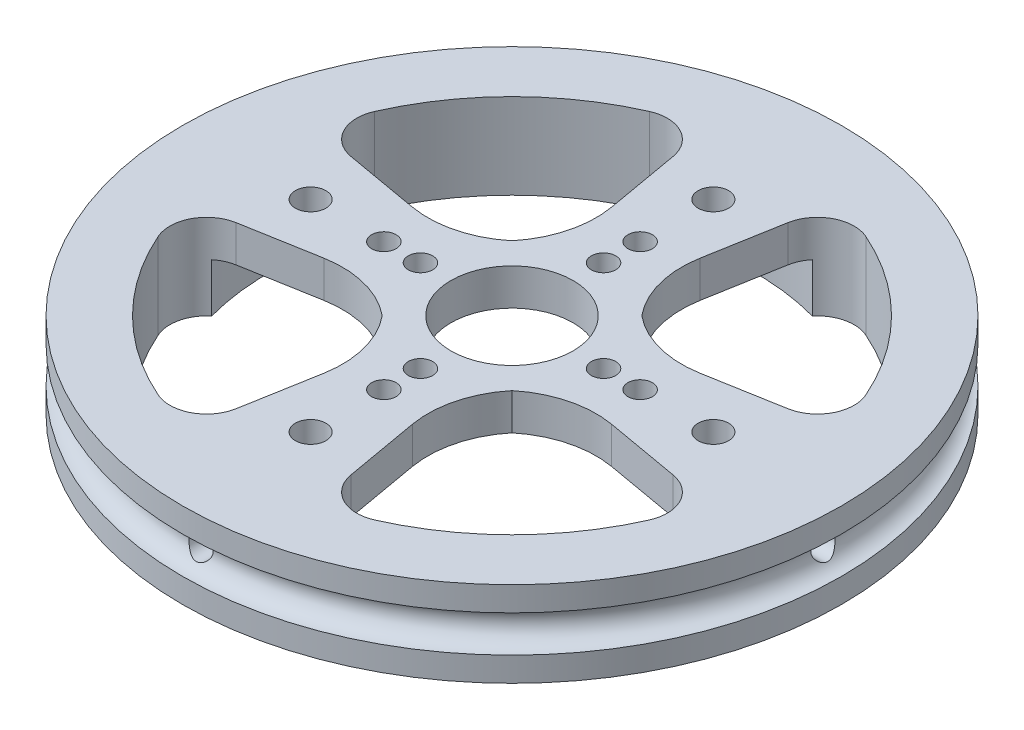
from build123d import *

# Parameters (mm, degrees)
SKETCH1_R           = 27
SKETCH1_R_2         = 5
SKETCH1_R_3         = 1
SKETCH1_R_4         = 1.25
BOSS_EXTRUDE1_DEPTH = 2
SKETCH3_R           = 27
SKETCH3_R_2         = 1.25
SKETCH3_R_3         = 1
SKETCH3_R_4         = 5
BOSS_EXTRUDE3_DEPTH = 2
SKETCH5_R           = 20
CUT_EXTRUDE1_DEPTH  = 4
SKETCH7_R           = 1
CUT_EXTRUDE2_DEPTH  = 7
CIRPATTERN1_COUNT   = 4
FILLET2_R           = 2
CUT_EXTRUDE3_START  = -10
SKETCH10_R          = 5
SKETCH10_R_2        = 1.25
SKETCH10_R_3        = 1
CUT_EXTRUDE3_DEPTH  = 10
FILLET3_R           = 8
FILLET4_R           = 3


with BuildPart() as part:
    # Sketch1 → Boss-Extrude1 (new body)
    with BuildSketch(Plane(origin=(0, 0, 0), x_dir=(1, 0, 0), z_dir=(0, 1, 0))):
        with Locations(Location((0, 0, 0), (0, 0, 270))):
            Circle(SKETCH1_R)
        with Locations(Location((0, 0, 0), (0, 0, 270))):
            Circle(SKETCH1_R_2, mode=Mode.SUBTRACT)
        with Locations(Location((-7.5, 0, 0), (0, 0, 270))):
            Circle(SKETCH1_R_3, mode=Mode.SUBTRACT)
        with Locations(Location((-10.5, 0, 0), (0, 0, 270))):
            Circle(SKETCH1_R_3, mode=Mode.SUBTRACT)
        with Locations(Location((0, 10.5, 0), (0, 0, 270))):
            Circle(SKETCH1_R_3, mode=Mode.SUBTRACT)
        with Locations(Location((10.5, 0, 0), (0, 0, 270))):
            Circle(SKETCH1_R_3, mode=Mode.SUBTRACT)
        with Locations(Location((0, -10.5, 0), (0, 0, 270))):
            Circle(SKETCH1_R_3, mode=Mode.SUBTRACT)
        with Locations(Location((0, 7.5, 0), (0, 0, 270))):
            Circle(SKETCH1_R_3, mode=Mode.SUBTRACT)
        with Locations(Location((7.5, 0, 0), (0, 0, 270))):
            Circle(SKETCH1_R_3, mode=Mode.SUBTRACT)
        with Locations(Location((0, -7.5, 0), (0, 0, 270))):
            Circle(SKETCH1_R_3, mode=Mode.SUBTRACT)
        with Locations(Location((-16.5, 0, 0), (0, 0, 270))):
            Circle(SKETCH1_R_4, mode=Mode.SUBTRACT)
        with Locations(Location((0, 16.5, 0), (0, 0, 270))):
            Circle(SKETCH1_R_4, mode=Mode.SUBTRACT)
        with Locations(Location((16.5, 0, 0), (0, 0, 270))):
            Circle(SKETCH1_R_4, mode=Mode.SUBTRACT)
        with Locations(Location((0, -16.5, 0), (0, 0, 270))):
            Circle(SKETCH1_R_4, mode=Mode.SUBTRACT)
        with BuildLine():
            Line((-6.968485669, 2.773122334), (-21.338950819, 5.307023065))
            ThreePointArc((-21.338950819, 5.307023065), (-15.548558066, 15.548558066), (-5.307023065, 21.338950819))
            Line((-5.307023065, 21.338950819), (-2.773122334, 6.968485669))
            ThreePointArc((-2.773122334, 6.968485669), (-5.303300859, 5.303300859), (-6.968485669, 2.773122334))
        make_face(mode=Mode.SUBTRACT)
        with BuildLine():
            Line((6.968485669, 2.773122334), (21.338950819, 5.307023065))
            ThreePointArc((21.338950819, 5.307023065), (15.548558066, 15.548558066), (5.307023065, 21.338950819))
            Line((5.307023065, 21.338950819), (2.773122334, 6.968485669))
            ThreePointArc((2.773122334, 6.968485669), (5.303300859, 5.303300859), (6.968485669, 2.773122334))
        make_face(mode=Mode.SUBTRACT)
        with BuildLine():
            Line((2.773122334, -6.968485669), (5.307023065, -21.338950819))
            ThreePointArc((5.307023065, -21.338950819), (15.548558066, -15.548558066), (21.338950819, -5.307023065))
            Line((21.338950819, -5.307023065), (6.968485669, -2.773122334))
            ThreePointArc((6.968485669, -2.773122334), (5.303300859, -5.303300859), (2.773122334, -6.968485669))
        make_face(mode=Mode.SUBTRACT)
        with BuildLine():
            Line((-6.968485669, -2.773122334), (-21.338950819, -5.307023065))
            ThreePointArc((-21.338950819, -5.307023065), (-15.548558066, -15.548558066), (-5.307023065, -21.338950819))
            Line((-5.307023065, -21.338950819), (-2.773122334, -6.968485669))
            ThreePointArc((-2.773122334, -6.968485669), (-5.303300859, -5.303300859), (-6.968485669, -2.773122334))
        make_face(mode=Mode.SUBTRACT)
    extrude(amount=BOSS_EXTRUDE1_DEPTH)



with BuildPart() as body_2:
    # Sketch3 → Boss-Extrude3 (new body)
    with BuildSketch(Plane(origin=(0, 5, 0), x_dir=(1, 0, 0), z_dir=(0, 1, 0))):
        with Locations(Location((0, 0, 0), (0, 0, 270))):
            Circle(SKETCH3_R)
        with Locations(Location((0, -16.5, 0), (0, 0, 270))):
            Circle(SKETCH3_R_2, mode=Mode.SUBTRACT)
        with Locations(Location((0, -7.5, 0), (0, 0, 270))):
            Circle(SKETCH3_R_3, mode=Mode.SUBTRACT)
        with Locations(Location((0, -10.5, 0), (0, 0, 270))):
            Circle(SKETCH3_R_3, mode=Mode.SUBTRACT)
        with Locations(Location((16.5, 0, 0), (0, 0, 270))):
            Circle(SKETCH3_R_2, mode=Mode.SUBTRACT)
        with Locations(Location((10.5, 0, 0), (0, 0, 270))):
            Circle(SKETCH3_R_3, mode=Mode.SUBTRACT)
        with Locations(Location((7.5, 0, 0), (0, 0, 270))):
            Circle(SKETCH3_R_3, mode=Mode.SUBTRACT)
        with Locations(Location((-7.5, 0, 0), (0, 0, 270))):
            Circle(SKETCH3_R_3, mode=Mode.SUBTRACT)
        with Locations(Location((-10.5, 0, 0), (0, 0, 270))):
            Circle(SKETCH3_R_3, mode=Mode.SUBTRACT)
        with Locations(Location((-16.5, 0, 0), (0, 0, 270))):
            Circle(SKETCH3_R_2, mode=Mode.SUBTRACT)
        with Locations(Location((0, 0, 0), (0, 0, 270))):
            Circle(SKETCH3_R_4, mode=Mode.SUBTRACT)
        with Locations(Location((0, 7.5, 0), (0, 0, 270))):
            Circle(SKETCH3_R_3, mode=Mode.SUBTRACT)
        with Locations(Location((0, 10.5, 0), (0, 0, 270))):
            Circle(SKETCH3_R_3, mode=Mode.SUBTRACT)
        with Locations(Location((0, 16.5, 0), (0, 0, 270))):
            Circle(SKETCH3_R_2, mode=Mode.SUBTRACT)
        with BuildLine():
            Line((6.968485669, -2.773122334), (21.338950819, -5.307023065))
            ThreePointArc((21.338950819, -5.307023065), (15.548558066, -15.548558066), (5.307023065, -21.338950819))
            Line((5.307023065, -21.338950819), (2.773122334, -6.968485669))
            ThreePointArc((2.773122334, -6.968485669), (5.303300859, -5.303300859), (6.968485669, -2.773122334))
        make_face(mode=Mode.SUBTRACT)
        with BuildLine():
            Line((-2.773122334, -6.968485669), (-5.307023065, -21.338950819))
            ThreePointArc((-5.307023065, -21.338950819), (-15.548558066, -15.548558066), (-21.338950819, -5.307023065))
            Line((-21.338950819, -5.307023065), (-6.968485669, -2.773122334))
            ThreePointArc((-6.968485669, -2.773122334), (-5.303300859, -5.303300859), (-2.773122334, -6.968485669))
        make_face(mode=Mode.SUBTRACT)
        with BuildLine():
            Line((2.773122334, 6.968485669), (5.307023065, 21.338950819))
            ThreePointArc((5.307023065, 21.338950819), (15.548558066, 15.548558066), (21.338950819, 5.307023065))
            Line((21.338950819, 5.307023065), (6.968485669, 2.773122334))
            ThreePointArc((6.968485669, 2.773122334), (5.303300859, 5.303300859), (2.773122334, 6.968485669))
        make_face(mode=Mode.SUBTRACT)
        with BuildLine():
            Line((-2.773122334, 6.968485669), (-5.307023065, 21.338950819))
            ThreePointArc((-5.307023065, 21.338950819), (-15.548558066, 15.548558066), (-21.338950819, 5.307023065))
            Line((-21.338950819, 5.307023065), (-6.968485669, 2.773122334))
            ThreePointArc((-6.968485669, 2.773122334), (-5.303300859, 5.303300859), (-2.773122334, 6.968485669))
        make_face(mode=Mode.SUBTRACT)
    extrude(amount=BOSS_EXTRUDE3_DEPTH)


with BuildPart() as part_1:
    add(part.part)

    add(body_2.part)  # Revolve1 merges body 2
    # Sketch9 → Revolve1 (revolve)
    with BuildSketch(Plane(origin=(0, 0, 0), x_dir=(0, 0, -1), z_dir=(1, 0, 0))):
        with BuildLine():
            ThreePointArc((-27, 2), (-25.5, 3.5), (-27, 5))
            Line((-27, 5), (0, 5))
            Line((0, 5), (0, 2))
            Line((0, 2), (-27, 2))
        make_face()
    revolve(axis=Axis((0, 5, 0), (0, -1, 0)))

    # Sketch5 → Cut-Extrude1 (cut)
    with BuildSketch(Plane.XZ):
        with Locations(Location((0, 0, 0), (0, 0, 270))):
            Circle(SKETCH5_R)
    extrude(amount=-CUT_EXTRUDE1_DEPTH, mode=Mode.SUBTRACT)

    # Sketch7 → Cut-Extrude2 (cut)
    with BuildSketch(Plane(origin=(0, 3.5, 27.946108068), x_dir=(1, 0, 0), z_dir=(0, 0, 1))):
        Circle(SKETCH7_R)
    cut_extrude2 = extrude(amount=-CUT_EXTRUDE2_DEPTH, mode=Mode.SUBTRACT)

    # CirPattern1: Cut-Extrude2 ×4 about axis
    cirpattern1_axis = Axis((0, 0, 0), (0, 1, 0))
    for i in range(1, CIRPATTERN1_COUNT):
        add(cut_extrude2.rotate(cirpattern1_axis, i * 360 / CIRPATTERN1_COUNT), mode=Mode.SUBTRACT)

    # Fillet2
    # the kernel refuses this fillet: 2 mm, written as the material it adds along each edge
    with BuildSketch(Plane(origin=(21.338950819, 0, -5.307023065), x_dir=(-0.2928806742578109, 0, -0.9561490002328561), z_dir=(0, 1, 0))) as fillet2_piece_1_section:
        with BuildLine():
            CenterArc((2.244009328, 1.997140322), FILLET2_R, 180.512838978, 92.551473048)
            Line((0.244089443, 1.979239103), (0, 0))
            ThreePointArc((0, 0), (1.175461506, -0.031440707), (2.350923011, 0))
        make_face()
    fillet2_piece_1 = extrude(amount=7.877307528, mode=Mode.PRIVATE)
    fillet2_piece_1 = split(fillet2_piece_1, bisect_by=Plane(origin=(21.338950819, 4, -5.307023065), z_dir=(0, -1, 0)), keep=Keep.TOP, mode=Mode.PRIVATE)
    add(fillet2_piece_1)
    with BuildSketch(Plane(origin=(-5.307023065, 0, 21.338950819), x_dir=(0.17364817766693164, 0, -0.9848077530122079), z_dir=(0, 1, 0))) as fillet2_piece_2_section:
        with BuildLine():
            CenterArc((2.256785528, 1.982691708), FILLET2_R, 169.905191232, 92.551473048)
            ThreePointArc((0.287747398, 2.333246759), (0.11266939, 1.170471648), (0, 0))
            Line((0, 0), (1.994233458, 0))
        make_face()
    fillet2_piece_2 = extrude(amount=7.877307528, mode=Mode.PRIVATE)
    fillet2_piece_2 = split(fillet2_piece_2, bisect_by=Plane(origin=(-5.307023065, 4, 21.338950819), z_dir=(0, -1, 0)), keep=Keep.TOP, mode=Mode.PRIVATE)
    add(fillet2_piece_2)
    with BuildSketch(Plane(origin=(5.307023065, 0, -21.338950819), x_dir=(-0.17364817766693164, 0, 0.9848077530122079), z_dir=(0, 1, 0))) as fillet2_piece_3_section:
        with BuildLine():
            CenterArc((2.256785528, 1.982691708), FILLET2_R, 169.905191232, 92.551473048)
            ThreePointArc((0.287747398, 2.333246759), (0.11266939, 1.170471648), (0, 0))
            Line((0, 0), (1.994233458, 0))
        make_face()
    fillet2_piece_3 = extrude(amount=7.877307528, mode=Mode.PRIVATE)
    fillet2_piece_3 = split(fillet2_piece_3, bisect_by=Plane(origin=(5.307023065, 4, -21.338950819), z_dir=(0, -1, 0)), keep=Keep.TOP, mode=Mode.PRIVATE)
    add(fillet2_piece_3)
    with BuildSketch(Plane(origin=(-21.338950819, 0, 5.307023065), x_dir=(0.29288067425780917, 0, 0.9561490002328565), z_dir=(0, 1, 0))) as fillet2_piece_4_section:
        with BuildLine():
            CenterArc((2.244009328, 1.997140322), FILLET2_R, 180.512838978, 92.551473048)
            Line((0.244089443, 1.979239103), (0, 0))
            ThreePointArc((0, 0), (1.175461506, -0.031440707), (2.350923011, 0))
        make_face()
    fillet2_piece_4 = extrude(amount=7.877307528, mode=Mode.PRIVATE)
    fillet2_piece_4 = split(fillet2_piece_4, bisect_by=Plane(origin=(-21.338950819, 4, 5.307023065), z_dir=(0, -1, 0)), keep=Keep.TOP, mode=Mode.PRIVATE)
    add(fillet2_piece_4)
    with BuildSketch(Plane(origin=(-5.307023065, 0, -21.338950819), x_dir=(0.17364817766692645, 0, 0.9848077530122088), z_dir=(0, 1, 0))) as fillet2_piece_5_section:
        with BuildLine():
            CenterArc((2.256785528, -1.982691708), FILLET2_R, 97.543335721, 92.551473048)
            ThreePointArc((0.287747398, -2.333246759), (0.11266939, -1.170471648), (0, 0))
            Line((0, 0), (1.994233458, 0))
        make_face()
    fillet2_piece_5 = extrude(amount=7.877307528, mode=Mode.PRIVATE)
    fillet2_piece_5 = split(fillet2_piece_5, bisect_by=Plane(origin=(-5.307023065, 4, -21.338950819), z_dir=(0, -1, 0)), keep=Keep.TOP, mode=Mode.PRIVATE)
    add(fillet2_piece_5)
    with BuildSketch(Plane(origin=(21.338950819, 0, 5.307023065), x_dir=(-0.9848077530122079, 0, -0.1736481776669312), z_dir=(0, 1, 0))) as fillet2_piece_6_section:
        with BuildLine():
            CenterArc((2.256785528, 1.982691708), FILLET2_R, 169.905191232, 92.551473048)
            ThreePointArc((0.287747398, 2.333246759), (0.11266939, 1.170471648), (0, 0))
            Line((0, 0), (1.994233458, 0))
        make_face()
    fillet2_piece_6 = extrude(amount=7.877307528, mode=Mode.PRIVATE)
    fillet2_piece_6 = split(fillet2_piece_6, bisect_by=Plane(origin=(21.338950819, 4, 5.307023065), z_dir=(0, -1, 0)), keep=Keep.TOP, mode=Mode.PRIVATE)
    add(fillet2_piece_6)
    with BuildSketch(Plane(origin=(-21.338950819, 0, -5.307023065), x_dir=(0.9848077530122081, 0, 0.1736481776669301), z_dir=(0, 1, 0))) as fillet2_piece_7_section:
        with BuildLine():
            CenterArc((2.256785528, 1.982691708), FILLET2_R, 169.905191232, 92.551473048)
            ThreePointArc((0.287747398, 2.333246759), (0.11266939, 1.170471648), (0, 0))
            Line((0, 0), (1.994233458, 0))
        make_face()
    fillet2_piece_7 = extrude(amount=7.877307528, mode=Mode.PRIVATE)
    fillet2_piece_7 = split(fillet2_piece_7, bisect_by=Plane(origin=(-21.338950819, 4, -5.307023065), z_dir=(0, -1, 0)), keep=Keep.TOP, mode=Mode.PRIVATE)
    add(fillet2_piece_7)
    with BuildSketch(Plane(origin=(5.307023065, 0, 21.338950819), x_dir=(0.9561490002328564, 0, -0.2928806742578094), z_dir=(0, 1, 0))) as fillet2_piece_8_section:
        with BuildLine():
            CenterArc((2.244009328, 1.997140322), FILLET2_R, 180.512838978, 92.551473048)
            Line((0.244089443, 1.979239103), (0, 0))
            ThreePointArc((0, 0), (1.175461506, -0.031440707), (2.350923011, 0))
        make_face()
    fillet2_piece_8 = extrude(amount=7.877307528, mode=Mode.PRIVATE)
    fillet2_piece_8 = split(fillet2_piece_8, bisect_by=Plane(origin=(5.307023065, 4, 21.338950819), z_dir=(0, -1, 0)), keep=Keep.TOP, mode=Mode.PRIVATE)
    add(fillet2_piece_8)

    # Sketch10 → Cut-Extrude3 (cut)
    with BuildSketch(Plane(origin=(0, 5, 0), x_dir=(1, 0, 0), z_dir=(0, 1, 0)).offset(CUT_EXTRUDE3_START)):
        with Locations(Location((0, 0, 0), (0, 0, 90))):
            Circle(SKETCH10_R)
        with Locations(Location((0, 16.5, 0), (0, 0, 90))):
            Circle(SKETCH10_R_2)
        with Locations(Location((0, 10.5, 0), (0, 0, 90))):
            Circle(SKETCH10_R_3)
        with Locations(Location((0, 7.5, 0), (0, 0, 90))):
            Circle(SKETCH10_R_3)
        with Locations(Location((0, -16.5, 0), (0, 0, 90))):
            Circle(SKETCH10_R_2)
        with Locations(Location((0, -7.5, 0), (0, 0, 90))):
            Circle(SKETCH10_R_3)
        with Locations(Location((0, -10.5, 0), (0, 0, 90))):
            Circle(SKETCH10_R_3)
        with Locations(Location((16.5, 0, 0), (0, 0, 90))):
            Circle(SKETCH10_R_2)
        with Locations(Location((10.5, 0, 0), (0, 0, 90))):
            Circle(SKETCH10_R_3)
        with Locations(Location((7.5, 0, 0), (0, 0, 90))):
            Circle(SKETCH10_R_3)
        with Locations(Location((-7.5, 0, 0), (0, 0, 90))):
            Circle(SKETCH10_R_3)
        with Locations(Location((-10.5, 0, 0), (0, 0, 90))):
            Circle(SKETCH10_R_3)
        with Locations(Location((-16.5, 0, 0), (0, 0, 90))):
            Circle(SKETCH10_R_2)
        with BuildLine():
            Line((2.773122334, -6.968485669), (5.307023065, -21.338950819))
            ThreePointArc((5.307023065, -21.338950819), (15.548558066, -15.548558066), (21.338950819, -5.307023065))
            Line((21.338950819, -5.307023065), (6.968485669, -2.773122334))
            ThreePointArc((6.968485669, -2.773122334), (5.303300859, -5.303300859), (2.773122334, -6.968485669))
        make_face()
        with BuildLine():
            Line((-6.968485669, -2.773122334), (-21.338950819, -5.307023065))
            ThreePointArc((-21.338950819, -5.307023065), (-15.548558066, -15.548558066), (-5.307023065, -21.338950819))
            Line((-5.307023065, -21.338950819), (-2.773122334, -6.968485669))
            ThreePointArc((-2.773122334, -6.968485669), (-5.303300859, -5.303300859), (-6.968485669, -2.773122334))
        make_face()
        with BuildLine():
            Line((5.307023065, 21.338950819), (2.773122334, 6.968485669))
            ThreePointArc((2.773122334, 6.968485669), (5.303300859, 5.303300859), (6.968485669, 2.773122334))
            Line((6.968485669, 2.773122334), (21.338950819, 5.307023065))
            ThreePointArc((21.338950819, 5.307023065), (15.548558066, 15.548558066), (5.307023065, 21.338950819))
        make_face()
        with BuildLine():
            Line((-21.338950819, 5.307023065), (-6.968485669, 2.773122334))
            ThreePointArc((-6.968485669, 2.773122334), (-5.303300859, 5.303300859), (-2.773122334, 6.968485669))
            Line((-2.773122334, 6.968485669), (-5.307023065, 21.338950819))
            ThreePointArc((-5.307023065, 21.338950819), (-15.548558066, 15.548558066), (-21.338950819, 5.307023065))
        make_face()
    extrude(amount=CUT_EXTRUDE3_DEPTH, mode=Mode.SUBTRACT)

    # Fillet3
    # the kernel refuses this fillet: 8 mm, written as the material it adds along each edge
    with BuildSketch(Plane(origin=(2.773122334, 4, 6.968485669), x_dir=(0.8211598257419389, 0, -0.5706982920838897), z_dir=(0, 1, 0)), Plane(origin=(6.968485669, 7, 2.773122334), x_dir=(-0.5706982920838898, 0, 0.8211598257419388), z_dir=(0, -1, 0)), Plane(origin=(-6.968485669, 4, 2.773122334), x_dir=(0.5706982920838898, 0, 0.8211598257419388), z_dir=(0, 1, 0)), Plane(origin=(-6.968485669, 7, -2.773122334), x_dir=(0.57069829208389, 0, -0.8211598257419386), z_dir=(0, -1, 0)), Plane(origin=(-2.773122334, 4, -6.968485669), x_dir=(-0.8211598257419388, 0, 0.5706982920838898), z_dir=(0, 1, 0)), Plane(origin=(2.773122334, 7, -6.968485669), x_dir=(0.8211598257419387, 0, 0.5706982920838899), z_dir=(0, -1, 0)), Plane(origin=(6.968485669, 4, -2.773122334), x_dir=(-0.5706982920838897, 0, -0.8211598257419389), z_dir=(0, 1, 0))) as fillet3_piece_1:
        with BuildLine():
            CenterArc((5.212493732, -7.791847101), FILLET3_R, 103.098756103, 52.102309747)
            Line((-2.049788518, -4.436365538), (0, 0))
            ThreePointArc((0, 0), (1.699726217, -0.195143342), (3.399452434, 0))
        make_face()
    extrude(amount=3)
    with BuildSketch(Plane(origin=(-2.773122334, 7, 6.968485669), x_dir=(-0.17364817766693025, 0, 0.9848077530122081), z_dir=(0, -1, 0))) as fillet3_piece_2:
        with BuildLine():
            CenterArc((4.887020786, 8), FILLET3_R, 217.897690253, 52.102309747)
            ThreePointArc((-1.425849996, 3.085972884), (-0.535776744, 1.624836428), (0, 0))
            Line((0, 0), (4.887020786, 0))
        make_face()
    extrude(amount=3)

    # Fillet4
    # the kernel refuses this fillet: 3 mm, written as the material it adds along each edge
    with BuildSketch(Plane(origin=(-21.338950819, 0, 5.307023065), x_dir=(0.9848077530122086, 0, -0.1736481776669276), z_dir=(0, 1, 0))) as fillet4_piece_1_section:
        with BuildLine():
            CenterArc((3.493362715, -3), FILLET4_R, 90, 103.77334368)
            ThreePointArc((0.579627264, -3.714244862), (0.210295472, -1.869531654), (0, 0))
            Line((0, 0), (3.493362715, 0))
        make_face()
    fillet4_piece_1 = extrude(amount=7, mode=Mode.PRIVATE)
    fillet4_piece_1 = split(fillet4_piece_1, bisect_by=Plane(origin=(-21.338950819, 4, 5.307023065), z_dir=(0, -1, 0)), keep=Keep.TOP, mode=Mode.PRIVATE)
    fillet4_piece_1 = fillet4_piece_1 - Plane(origin=(0, 0, 0), x_dir=(0, 0, -1), z_dir=(0, -1, 0)) * Cylinder(20, 29, mode=Mode.PRIVATE)
    add(fillet4_piece_1)
    with BuildSketch(Plane(origin=(-21.338950819, 0, 5.307023065), x_dir=(0.9848077530122086, 0, -0.1736481776669276), z_dir=(0, 1, 0))) as fillet4_piece_2_section:
        with BuildLine():
            CenterArc((3.493362715, -3), FILLET4_R, 90, 103.77334368)
            ThreePointArc((0.579627264, -3.714244862), (0.210295472, -1.869531654), (0, 0))
            Line((0, 0), (3.493362715, 0))
        make_face()
    fillet4_piece_2 = extrude(amount=7, mode=Mode.PRIVATE)
    fillet4_piece_2 = split(fillet4_piece_2, bisect_by=Plane(origin=(-21.338950819, 4, 5.307023065), z_dir=(0, 1, 0)), keep=Keep.TOP, mode=Mode.PRIVATE)
    fillet4_piece_2 = fillet4_piece_2 & Plane(origin=(0, 0, 0), x_dir=(0, 0, -1), z_dir=(0, -1, 0)) * Cylinder(20, 29, mode=Mode.PRIVATE)
    add(fillet4_piece_2)
    with BuildSketch(Plane(origin=(-21.338950819, 0, 5.307023065), x_dir=(0.9848077530122086, 0, -0.1736481776669276), z_dir=(0, 1, 0))) as fillet4_piece_3_section:
        with BuildLine():
            CenterArc((3.493362715, -3), FILLET4_R, 90, 103.77334368)
            ThreePointArc((0.579627264, -3.714244862), (0.210295472, -1.869531654), (0, 0))
            Line((0, 0), (3.493362715, 0))
        make_face()
    fillet4_piece_3 = extrude(amount=7, mode=Mode.PRIVATE)
    fillet4_piece_3 = split(fillet4_piece_3, bisect_by=Plane(origin=(-21.338950819, 4, 5.307023065), z_dir=(0, 1, 0)), keep=Keep.TOP, mode=Mode.PRIVATE)
    fillet4_piece_3 = fillet4_piece_3 - Plane(origin=(0, 0, 0), x_dir=(0, 0, -1), z_dir=(0, -1, 0)) * Cylinder(20, 29, mode=Mode.PRIVATE)
    add(fillet4_piece_3)
    with BuildSketch(Plane(origin=(-5.307023065, 0, 21.338950819), x_dir=(0.1736481776669305, -1.043705868325508e-15, -0.984807753012208), z_dir=(0, 1, 0))) as fillet4_piece_4_section:
        with BuildLine():
            CenterArc((3.493362715, 3), FILLET4_R, 166.22665632, 103.77334368)
            ThreePointArc((0.579627264, 3.714244862), (0.210295472, 1.869531654), (0, 0))
            Line((0, 0), (3.493362715, 0))
        make_face()
    fillet4_piece_4 = extrude(amount=7, mode=Mode.PRIVATE)
    fillet4_piece_4 = split(fillet4_piece_4, bisect_by=Plane(origin=(-5.307023065, 4, 21.338950819), z_dir=(0, -1, 0)), keep=Keep.TOP, mode=Mode.PRIVATE)
    fillet4_piece_4 = fillet4_piece_4 - Plane(origin=(0, 0, 0), x_dir=(0, 0, -1), z_dir=(0, -1, 0)) * Cylinder(20, 29, mode=Mode.PRIVATE)
    add(fillet4_piece_4)
    with BuildSketch(Plane(origin=(-5.307023065, 0, 21.338950819), x_dir=(0.1736481776669305, -1.043705868325508e-15, -0.984807753012208), z_dir=(0, 1, 0))) as fillet4_piece_5_section:
        with BuildLine():
            CenterArc((3.493362715, 3), FILLET4_R, 166.22665632, 103.77334368)
            ThreePointArc((0.579627264, 3.714244862), (0.210295472, 1.869531654), (0, 0))
            Line((0, 0), (3.493362715, 0))
        make_face()
    fillet4_piece_5 = extrude(amount=7, mode=Mode.PRIVATE)
    fillet4_piece_5 = split(fillet4_piece_5, bisect_by=Plane(origin=(-5.307023065, 4, 21.338950819), z_dir=(0, 1, 0)), keep=Keep.TOP, mode=Mode.PRIVATE)
    fillet4_piece_5 = fillet4_piece_5 & Plane(origin=(0, 0, 0), x_dir=(0, 0, -1), z_dir=(0, -1, 0)) * Cylinder(20, 29, mode=Mode.PRIVATE)
    add(fillet4_piece_5)
    with BuildSketch(Plane(origin=(-5.307023065, 0, 21.338950819), x_dir=(0.1736481776669305, -1.043705868325508e-15, -0.984807753012208), z_dir=(0, 1, 0))) as fillet4_piece_6_section:
        with BuildLine():
            CenterArc((3.493362715, 3), FILLET4_R, 166.22665632, 103.77334368)
            ThreePointArc((0.579627264, 3.714244862), (0.210295472, 1.869531654), (0, 0))
            Line((0, 0), (3.493362715, 0))
        make_face()
    fillet4_piece_6 = extrude(amount=7, mode=Mode.PRIVATE)
    fillet4_piece_6 = split(fillet4_piece_6, bisect_by=Plane(origin=(-5.307023065, 4, 21.338950819), z_dir=(0, 1, 0)), keep=Keep.TOP, mode=Mode.PRIVATE)
    fillet4_piece_6 = fillet4_piece_6 - Plane(origin=(0, 0, 0), x_dir=(0, 0, -1), z_dir=(0, -1, 0)) * Cylinder(20, 29, mode=Mode.PRIVATE)
    add(fillet4_piece_6)
    with BuildSketch(Plane(origin=(21.338950819, 7, 5.307023065), x_dir=(-0.984807753012208, 0, -0.17364817766693086), z_dir=(0, -1, 0))) as fillet4_piece_7_section:
        with BuildLine():
            CenterArc((3.493362715, -3), FILLET4_R, 90, 103.77334368)
            ThreePointArc((0.579627264, -3.714244862), (0.210295472, -1.869531654), (0, 0))
            Line((0, 0), (3.493362715, 0))
        make_face()
    fillet4_piece_7 = extrude(amount=7, mode=Mode.PRIVATE)
    fillet4_piece_7 = split(fillet4_piece_7, bisect_by=Plane(origin=(21.338950819, 4, 5.307023065), z_dir=(0, 1, 0)), keep=Keep.TOP, mode=Mode.PRIVATE)
    fillet4_piece_7 = fillet4_piece_7 & Plane(origin=(0, 7, 0), x_dir=(0, 0, -1), z_dir=(0, -1, 0)) * Cylinder(20, 29, mode=Mode.PRIVATE)
    add(fillet4_piece_7)
    with BuildSketch(Plane(origin=(21.338950819, 7, 5.307023065), x_dir=(-0.984807753012208, 0, -0.17364817766693086), z_dir=(0, -1, 0))) as fillet4_piece_8_section:
        with BuildLine():
            CenterArc((3.493362715, -3), FILLET4_R, 90, 103.77334368)
            ThreePointArc((0.579627264, -3.714244862), (0.210295472, -1.869531654), (0, 0))
            Line((0, 0), (3.493362715, 0))
        make_face()
    fillet4_piece_8 = extrude(amount=7, mode=Mode.PRIVATE)
    fillet4_piece_8 = split(fillet4_piece_8, bisect_by=Plane(origin=(21.338950819, 4, 5.307023065), z_dir=(0, 1, 0)), keep=Keep.TOP, mode=Mode.PRIVATE)
    fillet4_piece_8 = fillet4_piece_8 - Plane(origin=(0, 7, 0), x_dir=(0, 0, -1), z_dir=(0, -1, 0)) * Cylinder(20, 29, mode=Mode.PRIVATE)
    add(fillet4_piece_8)
    with BuildSketch(Plane(origin=(21.338950819, 7, 5.307023065), x_dir=(-0.984807753012208, 0, -0.17364817766693086), z_dir=(0, -1, 0))) as fillet4_piece_9_section:
        with BuildLine():
            CenterArc((3.493362715, -3), FILLET4_R, 90, 103.77334368)
            ThreePointArc((0.579627264, -3.714244862), (0.210295472, -1.869531654), (0, 0))
            Line((0, 0), (3.493362715, 0))
        make_face()
    fillet4_piece_9 = extrude(amount=7, mode=Mode.PRIVATE)
    fillet4_piece_9 = split(fillet4_piece_9, bisect_by=Plane(origin=(21.338950819, 4, 5.307023065), z_dir=(0, -1, 0)), keep=Keep.TOP, mode=Mode.PRIVATE)
    fillet4_piece_9 = fillet4_piece_9 - Plane(origin=(0, 7, 0), x_dir=(0, 0, -1), z_dir=(0, -1, 0)) * Cylinder(20, 29, mode=Mode.PRIVATE)
    add(fillet4_piece_9)
    with BuildSketch(Plane(origin=(5.307023065, 0, 21.338950819), x_dir=(-0.17364817766692778, 0, -0.9848077530122086), z_dir=(0, 1, 0))) as fillet4_piece_10_section:
        with BuildLine():
            CenterArc((3.493362715, -3), FILLET4_R, 90, 103.77334368)
            ThreePointArc((0.579627264, -3.714244862), (0.210295472, -1.869531654), (0, 0))
            Line((0, 0), (3.493362715, 0))
        make_face()
    fillet4_piece_10 = extrude(amount=7, mode=Mode.PRIVATE)
    fillet4_piece_10 = split(fillet4_piece_10, bisect_by=Plane(origin=(5.307023065, 4, 21.338950819), z_dir=(0, -1, 0)), keep=Keep.TOP, mode=Mode.PRIVATE)
    fillet4_piece_10 = fillet4_piece_10 - Plane(origin=(0, 0, 0), x_dir=(0, 0, -1), z_dir=(0, -1, 0)) * Cylinder(20, 29, mode=Mode.PRIVATE)
    add(fillet4_piece_10)
    with BuildSketch(Plane(origin=(5.307023065, 0, 21.338950819), x_dir=(-0.17364817766692778, 0, -0.9848077530122086), z_dir=(0, 1, 0))) as fillet4_piece_11_section:
        with BuildLine():
            CenterArc((3.493362715, -3), FILLET4_R, 90, 103.77334368)
            ThreePointArc((0.579627264, -3.714244862), (0.210295472, -1.869531654), (0, 0))
            Line((0, 0), (3.493362715, 0))
        make_face()
    fillet4_piece_11 = extrude(amount=7, mode=Mode.PRIVATE)
    fillet4_piece_11 = split(fillet4_piece_11, bisect_by=Plane(origin=(5.307023065, 4, 21.338950819), z_dir=(0, 1, 0)), keep=Keep.TOP, mode=Mode.PRIVATE)
    fillet4_piece_11 = fillet4_piece_11 & Plane(origin=(0, 0, 0), x_dir=(0, 0, -1), z_dir=(0, -1, 0)) * Cylinder(20, 29, mode=Mode.PRIVATE)
    add(fillet4_piece_11)
    with BuildSketch(Plane(origin=(5.307023065, 0, 21.338950819), x_dir=(-0.17364817766692778, 0, -0.9848077530122086), z_dir=(0, 1, 0))) as fillet4_piece_12_section:
        with BuildLine():
            CenterArc((3.493362715, -3), FILLET4_R, 90, 103.77334368)
            ThreePointArc((0.579627264, -3.714244862), (0.210295472, -1.869531654), (0, 0))
            Line((0, 0), (3.493362715, 0))
        make_face()
    fillet4_piece_12 = extrude(amount=7, mode=Mode.PRIVATE)
    fillet4_piece_12 = split(fillet4_piece_12, bisect_by=Plane(origin=(5.307023065, 4, 21.338950819), z_dir=(0, 1, 0)), keep=Keep.TOP, mode=Mode.PRIVATE)
    fillet4_piece_12 = fillet4_piece_12 - Plane(origin=(0, 0, 0), x_dir=(0, 0, -1), z_dir=(0, -1, 0)) * Cylinder(20, 29, mode=Mode.PRIVATE)
    add(fillet4_piece_12)
    with BuildSketch(Plane(origin=(-21.338950819, 0, -5.307023065), x_dir=(0.984807753012208, 0, 0.1736481776669309), z_dir=(0, 1, 0))) as fillet4_piece_13_section:
        with BuildLine():
            CenterArc((3.493362715, 3), FILLET4_R, 166.22665632, 103.77334368)
            ThreePointArc((0.579627264, 3.714244862), (0.210295472, 1.869531654), (0, 0))
            Line((0, 0), (3.493362715, 0))
        make_face()
    fillet4_piece_13 = extrude(amount=7, mode=Mode.PRIVATE)
    fillet4_piece_13 = split(fillet4_piece_13, bisect_by=Plane(origin=(-21.338950819, 4, -5.307023065), z_dir=(0, -1, 0)), keep=Keep.TOP, mode=Mode.PRIVATE)
    fillet4_piece_13 = fillet4_piece_13 - Plane(origin=(0, 0, 0), x_dir=(0, 0, -1), z_dir=(0, -1, 0)) * Cylinder(20, 29, mode=Mode.PRIVATE)
    add(fillet4_piece_13)
    with BuildSketch(Plane(origin=(-21.338950819, 0, -5.307023065), x_dir=(0.984807753012208, 0, 0.1736481776669309), z_dir=(0, 1, 0))) as fillet4_piece_14_section:
        with BuildLine():
            CenterArc((3.493362715, 3), FILLET4_R, 166.22665632, 103.77334368)
            ThreePointArc((0.579627264, 3.714244862), (0.210295472, 1.869531654), (0, 0))
            Line((0, 0), (3.493362715, 0))
        make_face()
    fillet4_piece_14 = extrude(amount=7, mode=Mode.PRIVATE)
    fillet4_piece_14 = split(fillet4_piece_14, bisect_by=Plane(origin=(-21.338950819, 4, -5.307023065), z_dir=(0, 1, 0)), keep=Keep.TOP, mode=Mode.PRIVATE)
    fillet4_piece_14 = fillet4_piece_14 & Plane(origin=(0, 0, 0), x_dir=(0, 0, -1), z_dir=(0, -1, 0)) * Cylinder(20, 29, mode=Mode.PRIVATE)
    add(fillet4_piece_14)
    with BuildSketch(Plane(origin=(-21.338950819, 0, -5.307023065), x_dir=(0.984807753012208, 0, 0.1736481776669309), z_dir=(0, 1, 0))) as fillet4_piece_15_section:
        with BuildLine():
            CenterArc((3.493362715, 3), FILLET4_R, 166.22665632, 103.77334368)
            ThreePointArc((0.579627264, 3.714244862), (0.210295472, 1.869531654), (0, 0))
            Line((0, 0), (3.493362715, 0))
        make_face()
    fillet4_piece_15 = extrude(amount=7, mode=Mode.PRIVATE)
    fillet4_piece_15 = split(fillet4_piece_15, bisect_by=Plane(origin=(-21.338950819, 4, -5.307023065), z_dir=(0, 1, 0)), keep=Keep.TOP, mode=Mode.PRIVATE)
    fillet4_piece_15 = fillet4_piece_15 - Plane(origin=(0, 0, 0), x_dir=(0, 0, -1), z_dir=(0, -1, 0)) * Cylinder(20, 29, mode=Mode.PRIVATE)
    add(fillet4_piece_15)
    with BuildSketch(Plane(origin=(21.338950819, 0, -5.307023065), x_dir=(-0.9848077530122087, 0, 0.17364817766692686), z_dir=(0, 1, 0))) as fillet4_piece_16_section:
        with BuildLine():
            CenterArc((3.493362715, -3), FILLET4_R, 90, 103.77334368)
            ThreePointArc((0.579627264, -3.714244862), (0.210295472, -1.869531654), (0, 0))
            Line((0, 0), (3.493362715, 0))
        make_face()
    fillet4_piece_16 = extrude(amount=7, mode=Mode.PRIVATE)
    fillet4_piece_16 = split(fillet4_piece_16, bisect_by=Plane(origin=(21.338950819, 4, -5.307023065), z_dir=(0, -1, 0)), keep=Keep.TOP, mode=Mode.PRIVATE)
    fillet4_piece_16 = fillet4_piece_16 - Plane(origin=(0, 0, 0), x_dir=(0, 0, -1), z_dir=(0, -1, 0)) * Cylinder(20, 29, mode=Mode.PRIVATE)
    add(fillet4_piece_16)
    with BuildSketch(Plane(origin=(21.338950819, 0, -5.307023065), x_dir=(-0.9848077530122087, 0, 0.17364817766692686), z_dir=(0, 1, 0))) as fillet4_piece_17_section:
        with BuildLine():
            CenterArc((3.493362715, -3), FILLET4_R, 90, 103.77334368)
            ThreePointArc((0.579627264, -3.714244862), (0.210295472, -1.869531654), (0, 0))
            Line((0, 0), (3.493362715, 0))
        make_face()
    fillet4_piece_17 = extrude(amount=7, mode=Mode.PRIVATE)
    fillet4_piece_17 = split(fillet4_piece_17, bisect_by=Plane(origin=(21.338950819, 4, -5.307023065), z_dir=(0, 1, 0)), keep=Keep.TOP, mode=Mode.PRIVATE)
    fillet4_piece_17 = fillet4_piece_17 & Plane(origin=(0, 0, 0), x_dir=(0, 0, -1), z_dir=(0, -1, 0)) * Cylinder(20, 29, mode=Mode.PRIVATE)
    add(fillet4_piece_17)
    with BuildSketch(Plane(origin=(21.338950819, 0, -5.307023065), x_dir=(-0.9848077530122087, 0, 0.17364817766692686), z_dir=(0, 1, 0))) as fillet4_piece_18_section:
        with BuildLine():
            CenterArc((3.493362715, -3), FILLET4_R, 90, 103.77334368)
            ThreePointArc((0.579627264, -3.714244862), (0.210295472, -1.869531654), (0, 0))
            Line((0, 0), (3.493362715, 0))
        make_face()
    fillet4_piece_18 = extrude(amount=7, mode=Mode.PRIVATE)
    fillet4_piece_18 = split(fillet4_piece_18, bisect_by=Plane(origin=(21.338950819, 4, -5.307023065), z_dir=(0, 1, 0)), keep=Keep.TOP, mode=Mode.PRIVATE)
    fillet4_piece_18 = fillet4_piece_18 - Plane(origin=(0, 0, 0), x_dir=(0, 0, -1), z_dir=(0, -1, 0)) * Cylinder(20, 29, mode=Mode.PRIVATE)
    add(fillet4_piece_18)
    with BuildSketch(Plane(origin=(-5.307023065, 0, -21.338950819), x_dir=(0.1736481776669272, 0, 0.9848077530122086), z_dir=(0, 1, 0))) as fillet4_piece_19_section:
        with BuildLine():
            CenterArc((3.493362715, -3), FILLET4_R, 90, 103.77334368)
            ThreePointArc((0.579627264, -3.714244862), (0.210295472, -1.869531654), (0, 0))
            Line((0, 0), (3.493362715, 0))
        make_face()
    fillet4_piece_19 = extrude(amount=7, mode=Mode.PRIVATE)
    fillet4_piece_19 = split(fillet4_piece_19, bisect_by=Plane(origin=(-5.307023065, 4, -21.338950819), z_dir=(0, -1, 0)), keep=Keep.TOP, mode=Mode.PRIVATE)
    fillet4_piece_19 = fillet4_piece_19 - Plane(origin=(0, 0, 0), x_dir=(0, 0, -1), z_dir=(0, -1, 0)) * Cylinder(20, 29, mode=Mode.PRIVATE)
    add(fillet4_piece_19)
    with BuildSketch(Plane(origin=(-5.307023065, 0, -21.338950819), x_dir=(0.1736481776669272, 0, 0.9848077530122086), z_dir=(0, 1, 0))) as fillet4_piece_20_section:
        with BuildLine():
            CenterArc((3.493362715, -3), FILLET4_R, 90, 103.77334368)
            ThreePointArc((0.579627264, -3.714244862), (0.210295472, -1.869531654), (0, 0))
            Line((0, 0), (3.493362715, 0))
        make_face()
    fillet4_piece_20 = extrude(amount=7, mode=Mode.PRIVATE)
    fillet4_piece_20 = split(fillet4_piece_20, bisect_by=Plane(origin=(-5.307023065, 4, -21.338950819), z_dir=(0, 1, 0)), keep=Keep.TOP, mode=Mode.PRIVATE)
    fillet4_piece_20 = fillet4_piece_20 & Plane(origin=(0, 0, 0), x_dir=(0, 0, -1), z_dir=(0, -1, 0)) * Cylinder(20, 29, mode=Mode.PRIVATE)
    add(fillet4_piece_20)
    with BuildSketch(Plane(origin=(-5.307023065, 0, -21.338950819), x_dir=(0.1736481776669272, 0, 0.9848077530122086), z_dir=(0, 1, 0))) as fillet4_piece_21_section:
        with BuildLine():
            CenterArc((3.493362715, -3), FILLET4_R, 90, 103.77334368)
            ThreePointArc((0.579627264, -3.714244862), (0.210295472, -1.869531654), (0, 0))
            Line((0, 0), (3.493362715, 0))
        make_face()
    fillet4_piece_21 = extrude(amount=7, mode=Mode.PRIVATE)
    fillet4_piece_21 = split(fillet4_piece_21, bisect_by=Plane(origin=(-5.307023065, 4, -21.338950819), z_dir=(0, 1, 0)), keep=Keep.TOP, mode=Mode.PRIVATE)
    fillet4_piece_21 = fillet4_piece_21 - Plane(origin=(0, 0, 0), x_dir=(0, 0, -1), z_dir=(0, -1, 0)) * Cylinder(20, 29, mode=Mode.PRIVATE)
    add(fillet4_piece_21)
    with BuildSketch(Plane(origin=(5.307023065, 0, -21.338950819), x_dir=(-0.17364817766693066, 0, 0.984807753012208), z_dir=(0, 1, 0))) as fillet4_piece_22_section:
        with BuildLine():
            CenterArc((3.493362715, 3), FILLET4_R, 166.22665632, 103.77334368)
            ThreePointArc((0.579627264, 3.714244862), (0.210295472, 1.869531654), (0, 0))
            Line((0, 0), (3.493362715, 0))
        make_face()
    fillet4_piece_22 = extrude(amount=7, mode=Mode.PRIVATE)
    fillet4_piece_22 = split(fillet4_piece_22, bisect_by=Plane(origin=(5.307023065, 4, -21.338950819), z_dir=(0, -1, 0)), keep=Keep.TOP, mode=Mode.PRIVATE)
    fillet4_piece_22 = fillet4_piece_22 - Plane(origin=(0, 0, 0), x_dir=(0, 0, -1), z_dir=(0, -1, 0)) * Cylinder(20, 29, mode=Mode.PRIVATE)
    add(fillet4_piece_22)
    with BuildSketch(Plane(origin=(5.307023065, 0, -21.338950819), x_dir=(-0.17364817766693066, 0, 0.984807753012208), z_dir=(0, 1, 0))) as fillet4_piece_23_section:
        with BuildLine():
            CenterArc((3.493362715, 3), FILLET4_R, 166.22665632, 103.77334368)
            ThreePointArc((0.579627264, 3.714244862), (0.210295472, 1.869531654), (0, 0))
            Line((0, 0), (3.493362715, 0))
        make_face()
    fillet4_piece_23 = extrude(amount=7, mode=Mode.PRIVATE)
    fillet4_piece_23 = split(fillet4_piece_23, bisect_by=Plane(origin=(5.307023065, 4, -21.338950819), z_dir=(0, 1, 0)), keep=Keep.TOP, mode=Mode.PRIVATE)
    fillet4_piece_23 = fillet4_piece_23 & Plane(origin=(0, 0, 0), x_dir=(0, 0, -1), z_dir=(0, -1, 0)) * Cylinder(20, 29, mode=Mode.PRIVATE)
    add(fillet4_piece_23)
    with BuildSketch(Plane(origin=(5.307023065, 0, -21.338950819), x_dir=(-0.17364817766693066, 0, 0.984807753012208), z_dir=(0, 1, 0))) as fillet4_piece_24_section:
        with BuildLine():
            CenterArc((3.493362715, 3), FILLET4_R, 166.22665632, 103.77334368)
            ThreePointArc((0.579627264, 3.714244862), (0.210295472, 1.869531654), (0, 0))
            Line((0, 0), (3.493362715, 0))
        make_face()
    fillet4_piece_24 = extrude(amount=7, mode=Mode.PRIVATE)
    fillet4_piece_24 = split(fillet4_piece_24, bisect_by=Plane(origin=(5.307023065, 4, -21.338950819), z_dir=(0, 1, 0)), keep=Keep.TOP, mode=Mode.PRIVATE)
    fillet4_piece_24 = fillet4_piece_24 - Plane(origin=(0, 0, 0), x_dir=(0, 0, -1), z_dir=(0, -1, 0)) * Cylinder(20, 29, mode=Mode.PRIVATE)
    add(fillet4_piece_24)


solid = part_1.part
